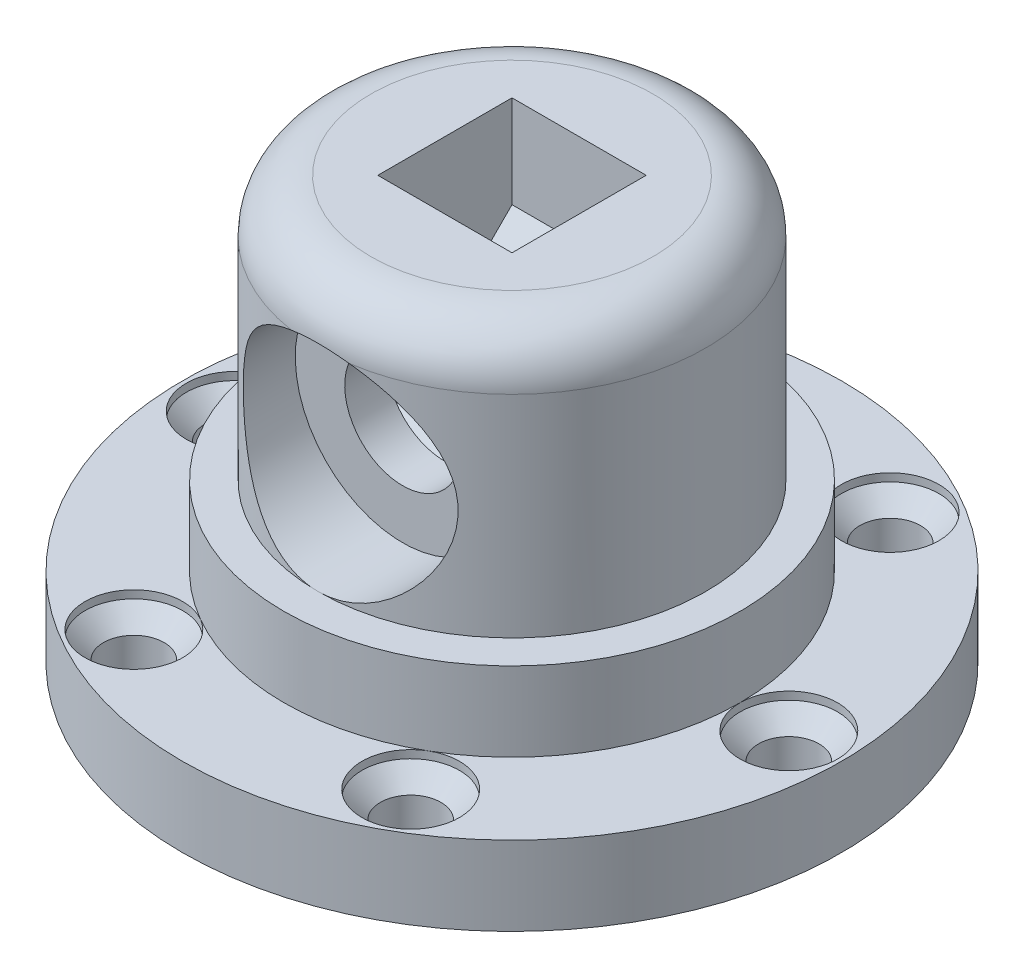
from build123d import *

# Parameters (mm, degrees)
SKETCH_1_R               = 12.5
EXTRUDE_1_DEPTH          = 6
SKETCH_4_R               = 1.15
CUT_EXTRUDE_2_DEPTH      = 19
SKETCH_3_R               = 7.5
CUT_EXTRUDE_3_DEPTH      = 5
CHAMFER_2_SIZE           = 0.7
SKETCH_8_R               = 17.454292773
SKETCH_8_R_2             = 8.65
CUT_EXTRUDE_4_DEPTH      = 3
PATTERN_CIRCULAR_2_COUNT = 6
SKETCH_2_R               = 7.34982993
EXTRUDE_2_DEPTH          = 10
SKETCH_9_R               = 1.85
CUT_EXTRUDE_5_DEPTH      = 0.3
CHAMFER_3_SIZE           = 0.7
PATTERN_CIRCULAR_3_COUNT = 6
CHAMFER_4_SIZE           = 0.7
SKETCH_10_W              = 5.09
SKETCH_10_H              = 5.09
CUT_EXTRUDE_6_DEPTH      = 8.6
FILLET_1_R               = 2
CHAMFER_5_SIZE           = 5.09


# Some blends are built 0.0001 mm under size
with BuildPart() as part:
    # 草图1 → 凸台-拉伸1 (new body)
    with BuildSketch(Plane(origin=(0, 0, 0), x_dir=(1, 0, 0), z_dir=(0, 1, 0))):
        with Locations(Location((0, 0, 0), (0, 0, 270))):
            Circle(SKETCH_1_R)
    extrude(amount=EXTRUDE_1_DEPTH)

    # 草图4 → 切除-拉伸2 (cut)
    with BuildSketch(Plane(origin=(0, 6, 0), x_dir=(1, 0, 0), z_dir=(0, 1, 0))):
        with Locations(Location((-10.5, 0, 0), (0, 0, 270))):
            Circle(SKETCH_4_R)
    cut_extrude_2 = extrude(amount=-CUT_EXTRUDE_2_DEPTH, mode=Mode.SUBTRACT)

    # 草图3 → 切除-拉伸3 (cut)
    with BuildSketch(Plane(origin=(0, 0, 0), x_dir=(-1, 0, 0), z_dir=(0, -1, 0))):
        with Locations(Location((0, 0, 0), (0, 0, 90))):
            Circle(SKETCH_3_R)
    extrude(amount=-CUT_EXTRUDE_3_DEPTH, mode=Mode.SUBTRACT)

    # 倒角2
    chamfer_2_edges = [part.edges().sort_by_distance(p)[0] for p in [
        (-10.5, 6, -1.15),
    ]]
    chamfer(chamfer_2_edges, length=CHAMFER_2_SIZE)

    # 草图8 → 切除-拉伸4 (cut)
    with BuildSketch(Plane(origin=(0, 6, 0), x_dir=(1, 0, 0), z_dir=(0, 1, 0))):
        Circle(SKETCH_8_R)
        with Locations(Location((0, 0, 0), (0, 0, 270))):
            Circle(SKETCH_8_R_2, mode=Mode.SUBTRACT)
    extrude(amount=-CUT_EXTRUDE_4_DEPTH, mode=Mode.SUBTRACT)

    # 阵列(圆周)2: 切除-拉伸2 ×6 about axis
    pattern_circular_2_axis = Axis((0, 0, 0), (0, 1, 0))
    for i in range(1, PATTERN_CIRCULAR_2_COUNT):
        add(cut_extrude_2.rotate(pattern_circular_2_axis, i * 360 / PATTERN_CIRCULAR_2_COUNT), mode=Mode.SUBTRACT)

    # 草图2 → 凸台-拉伸2 (add)
    with BuildSketch(Plane(origin=(0, 6, 0), x_dir=(1, 0, 0), z_dir=(0, 1, 0))):
        with Locations(Location((0, 0, 0), (0, 0, 270))):
            Circle(SKETCH_2_R)
    extrude(amount=EXTRUDE_2_DEPTH)

    # 草图9 → 切除-拉伸5 (cut)
    with BuildSketch(Plane(origin=(0, 3, 0), x_dir=(1, 0, 0), z_dir=(0, 1, 0))):
        with Locations(Location((-10.5, 0, 0), (0, 0, 270))):
            Circle(SKETCH_9_R)
    cut_extrude_5 = extrude(amount=-CUT_EXTRUDE_5_DEPTH, mode=Mode.SUBTRACT)

    # 倒角3
    chamfer_3_edges = [part.edges().sort_by_distance(p)[0] for p in [
        (-10.5, 2.7, -1.15),
    ]]
    chamfer(chamfer_3_edges, length=CHAMFER_3_SIZE - 0.0001)  # a hair under: the kernel refuses the full size

    # 阵列(圆周)3: 切除-拉伸5 ×6 about axis
    pattern_circular_3_axis = Axis((0, 0, 0), (0, 1, 0))
    for i in range(1, PATTERN_CIRCULAR_3_COUNT):
        add(cut_extrude_5.rotate(pattern_circular_3_axis, i * 360 / PATTERN_CIRCULAR_3_COUNT), mode=Mode.SUBTRACT)

    # 倒角4
    chamfer_4_edges = [part.edges().sort_by_distance(p)[0] for p in [
        (-4.254070786, 2.7, -9.66826674),
        (6.245929214, 2.7, -8.51826674),
        (10.5, 2.7, 1.15),
        (4.254070786, 2.7, 9.66826674),
        (-6.245929214, 2.7, 8.51826674),
    ]]
    chamfer(chamfer_4_edges, length=CHAMFER_4_SIZE - 0.0001)  # a hair under: the kernel refuses the full size

    # 草图10 → 切除-拉伸6 (cut)
    with BuildSketch(Plane(origin=(0, 16, 0), x_dir=(1, 0, 0), z_dir=(0, 1, 0))):
        Rectangle(SKETCH_10_W, SKETCH_10_H)
    extrude(amount=-CUT_EXTRUDE_6_DEPTH, mode=Mode.SUBTRACT)

    # 草图11 → 切除-旋转1 (revolve, cut)
    with BuildSketch(Plane(origin=(0, 0, 0), x_dir=(0, 0, -1), z_dir=(1, 0, 0)), mode=Mode.PRIVATE) as cut_revolve_1_sk:
        Polygon((-0.304897272, 10.075), (-10.874100718, 10.075), (-10.874100718, 6), (-4.145, 6), (-4.145, 7.875), (-2.545, 7.875), (-2.545, 9.125), (11.125701635, 9.125), (11.125701635, 10.075), align=None)
    revolve(cut_revolve_1_sk.sketch.rotate(Axis((0, 10.075, 0.304897272), (0, 0, 1)), 180), axis=Axis((0, 10.075, 0.304897272), (0, 0, 1)), mode=Mode.SUBTRACT)

    # 圆角1
    # the kernel refuses this fillet: 2 mm, written as the material it takes off along each edge
    with BuildSketch(Plane(origin=(0, 16, 0), x_dir=(0, 0, 1), z_dir=(-1, 0, 0))) as fillet_1_piece_1:
        with BuildLine():
            CenterArc((7.34982993 - FILLET_1_R, -FILLET_1_R), FILLET_1_R, 0, 90)
            Line((7.34982993 - FILLET_1_R, 0), (7.34982993, 0))
            Line((7.34982993, 0), (7.34982993, -FILLET_1_R))
        make_face()
    revolve(axis=Axis((0, 16, 0), (0, 1, 0)), mode=Mode.SUBTRACT)

    # 倒角5
    # the kernel refuses this chamfer: 5.09 mm, written as the material it adds along each edge
    with BuildSketch(Plane(origin=(2.545, 7.4, -2.545), x_dir=(0, 0.9996219169112968, -0.027495876610586393), z_dir=(-1, 0, 0))) as chamfer_5_piece_1_section:
        Polygon((CHAMFER_5_SIZE * 0.999621916911, -CHAMFER_5_SIZE * 0.0274958766106), (-CHAMFER_5_SIZE * 0.0274958766106, -CHAMFER_5_SIZE * 0.999621916911), (0, 0), align=None)
    chamfer_5_piece_1 = extrude(amount=5.09, mode=Mode.PRIVATE)
    chamfer_5_piece_1 = chamfer_5_piece_1 - Plane(origin=(0, 10.075, -0.813981716), x_dir=(0, 1, 0), z_dir=(0, 0, -1)) * Cylinder(0.95, 31, mode=Mode.PRIVATE)
    add(chamfer_5_piece_1)


solid = part.part
